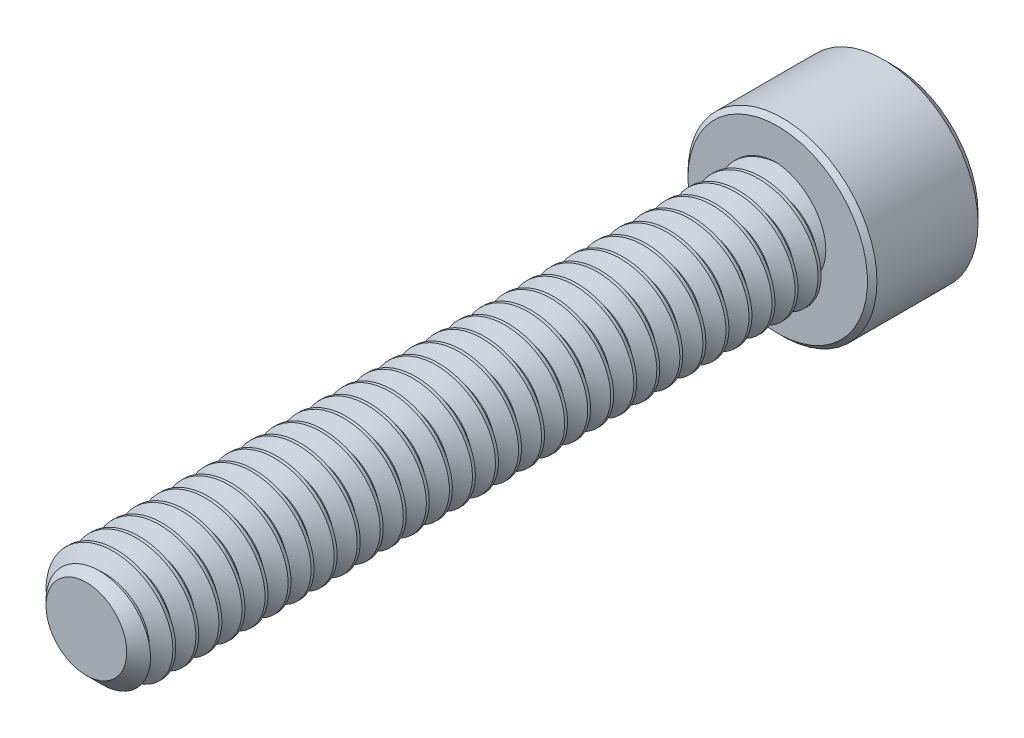
from build123d import *

# Parameters (mm, degrees)
SKETCH1_R          = 1.5875
EXTRUDE1_DEPTH     = 19.05
CHAMFER3_SIZE      = 0.47625
CUT_SWEEP1_PITCH   = 0.635
SKETCH6_R          = 2.6035
EXTRUDE2_DEPTH     = 3.175
CUT_EXTRUDE1_DEPTH = 1.7859375
CHAMFER1_SIZE      = 0.26035
CHAMFER2_SIZE      = 0.130175


with BuildPart() as part:
    # Sketch1 → Extrude1 (new body)
    with BuildSketch(Plane.XY):
        Circle(SKETCH1_R)
    extrude(amount=-EXTRUDE1_DEPTH)

    # Chamfer3
    chamfer3_edges = [part.edges().sort_by_distance(p)[0] for p in [
        (-1.5875, 0, 0),
    ]]
    chamfer(chamfer3_edges, length=CHAMFER3_SIZE)

    # Cut-Sweep1: arcs per turn and ends read off the stored shape
    # Cut-Sweep1: the profile of Sketch3 profile screwed along a right-hand helix through 32 turns, 6 arcs to a turn; built about Z, then put on its axis
    cut_sweep1_z = Axis((0, 0, 0), (0, 0, 1))
    cut_sweep1_corners = [(1.5878, 0, -0.555798205), (1.175055401, 0, -0.3175), (1.175055401, 0, -0.238125), (1.5878, 0, 0.000173205)]
    with BuildLine(mode=Mode.PRIVATE) as cut_sweep1_profile:
        Line(cut_sweep1_corners[0], cut_sweep1_corners[1])
        Line(cut_sweep1_corners[1], cut_sweep1_corners[2])
        Line(cut_sweep1_corners[2], cut_sweep1_corners[3])
        Line(cut_sweep1_corners[3], cut_sweep1_corners[0])
    cut_sweep1_cap = Face(cut_sweep1_profile.wire())
    cut_sweep1_turn_angles = [0, 30, 60, 90, 120, 150, 180, 210, 240, 270, 300, 330, 360]
    cut_sweep1_turn_weights = [1, 0.8660254037844387, 1, 0.8660254037844387, 1, 0.8660254037844387, 1, 0.8660254037844387, 1, 0.8660254037844387, 1, 0.8660254037844387, 1]
    cut_sweep1_turn_rails = [Edge.make_bspline([Vector(p[0], p[1], 0).rotate(cut_sweep1_z, cut_sweep1_turn_angles[k]) / cut_sweep1_turn_weights[k] + Vector(0, 0, p[2] + CUT_SWEEP1_PITCH * cut_sweep1_turn_angles[k] / 360) for k in range(13)], [0, 0, 0, 1, 1, 2, 2, 3, 3, 4, 4, 5, 5, 6, 6, 6], 2, cut_sweep1_turn_weights) for p in cut_sweep1_corners]
    cut_sweep1_turn_sides = [Face.make_surface_from_curves(cut_sweep1_turn_rails[p[0]], cut_sweep1_turn_rails[p[1]]) for p in [(0, 1), (1, 2), (2, 3), (3, 0)]]
    cut_sweep1 = Plane(origin=(0, 0, 0), x_dir=(0, 1, 0), z_dir=(0, 0, -1)) * Solid(Shell([*[p.moved(Location((0, 0, CUT_SWEEP1_PITCH * i))) for i in range(32) for p in cut_sweep1_turn_sides], cut_sweep1_cap, cut_sweep1_cap.rotate(cut_sweep1_z, 11520).moved(Location((0, 0, CUT_SWEEP1_PITCH * 11520 / 360)))]))
    add(cut_sweep1, mode=Mode.SUBTRACT)

    # Sketch6 → Extrude2 (add)
    with BuildSketch(Plane(origin=(0, 0, -19.05), x_dir=(-1, 0, 0), z_dir=(0, 0, -1))):
        Circle(SKETCH6_R)
    extrude(amount=EXTRUDE2_DEPTH)

    # Sketch7 → Cut-Extrude1 (cut)
    with BuildSketch(Plane(origin=(0, 0, -22.225), x_dir=(-1, 0, 0), z_dir=(0, 0, -1))):
        Polygon((0, 1.374815329), (-1.190625, 0.687407664), (-1.190625, -0.687407664), (0, -1.374815329), (1.190625, -0.687407664), (1.190625, 0.687407664), align=None)
    extrude(amount=-CUT_EXTRUDE1_DEPTH, mode=Mode.SUBTRACT)

    # Cut-Extrude2 cone 1 section (through the dimple's axis) → Cut-Extrude2 (revolve, cut)
    with BuildSketch(Plane(origin=(0, 0, -22.225), x_dir=(0, 1, 0), z_dir=(1, 0, 0))):
        Polygon((0, 0), (1.374815329, 0), (0, 1.374815329), align=None)
    revolve(axis=Axis((0, 0, -22.225), (0, 0, 1)), mode=Mode.SUBTRACT)

    # Chamfer1
    chamfer1_edges = [part.edges().sort_by_distance(p)[0] for p in [
        (2.6035, 0, -22.225),
    ]]
    chamfer(chamfer1_edges, length=CHAMFER1_SIZE)

    # Chamfer2
    chamfer2_edges = [part.edges().sort_by_distance(p)[0] for p in [
        (2.6035, 0, -19.05),
    ]]
    chamfer(chamfer2_edges, length=CHAMFER2_SIZE)


solid = part.part
